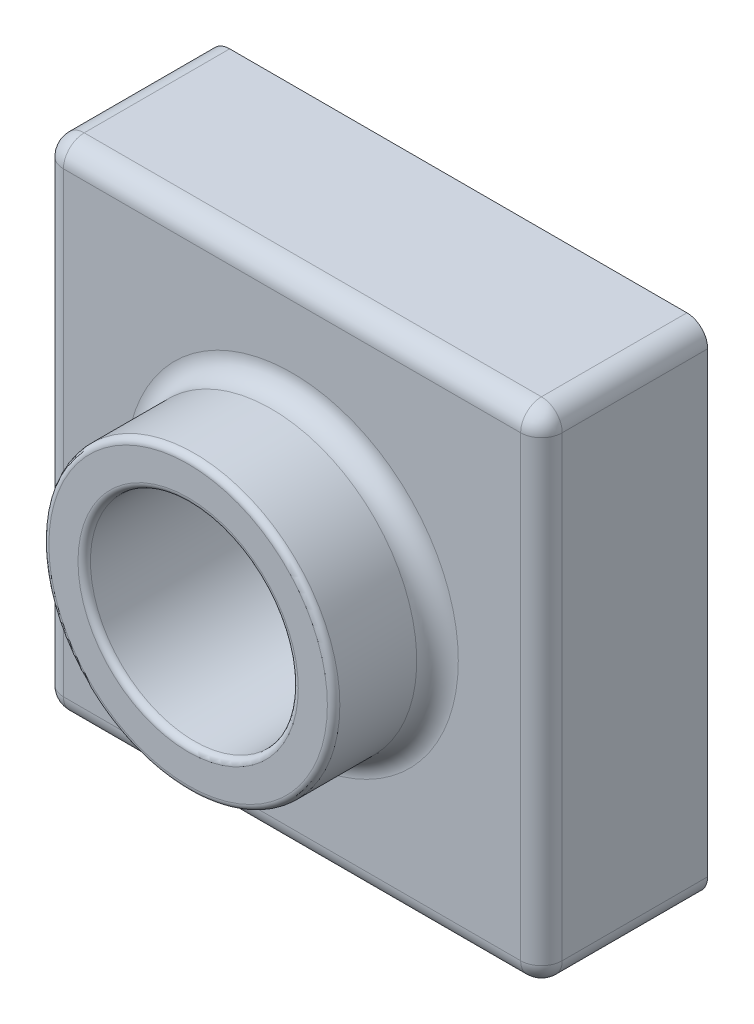
from build123d import *

# Parameters (mm, degrees)
SKETCH2_W           = 120
SKETCH2_H           = 120
BOSS_EXTRUDE1_DEPTH = 40
SKETCH3_R           = 35
BOSS_EXTRUDE2_DEPTH = 25
SKETCH4_R           = 25
CUT_EXTRUDE1_DEPTH  = 107.887791632
FILLET1_R           = 5
FILLET2_R           = 1.5
SHELL1_T            = -2


with BuildPart() as part:
    # Sketch2 → Boss-Extrude1 (new body)
    with BuildSketch(Plane.XY):
        Rectangle(SKETCH2_W, SKETCH2_H)
    extrude(amount=BOSS_EXTRUDE1_DEPTH)

    # Sketch3 → Boss-Extrude2 (add)
    with BuildSketch(Plane.XY.offset(40)):
        Circle(SKETCH3_R)
    extrude(amount=BOSS_EXTRUDE2_DEPTH)

    # Sketch4 → Cut-Extrude1 (cut, through all)
    with BuildSketch(Plane.XY.offset(65)):
        Circle(SKETCH4_R)
    extrude(amount=-CUT_EXTRUDE1_DEPTH, mode=Mode.SUBTRACT)

    # Fillet1
    fillet1_edges = [part.edges().sort_by_distance(p)[0] for p in [
        (0, -60, 40),
        (-60, 0, 40),
        (0, 60, 40),
        (60, 0, 40),
        (-35, 0, 40),
        (-60, 60, 20),
        (60, 60, 20),
        (60, -60, 20),
        (-60, -60, 20),
    ]]
    fillet(fillet1_edges, radius=FILLET1_R)

    # Fillet2
    fillet2_edges = [part.edges().sort_by_distance(p)[0] for p in [
        (-35, 0, 65),
        (-25, 0, 65),
    ]]
    fillet(fillet2_edges, radius=FILLET2_R)

    # Shell1
    shell1_openings = [part.faces().sort_by_distance(p)[0] for p in [
        (0, -58.302943725, 0),
    ]]
    offset(amount=SHELL1_T, openings=shell1_openings, kind=Kind.INTERSECTION)


solid = part.part
